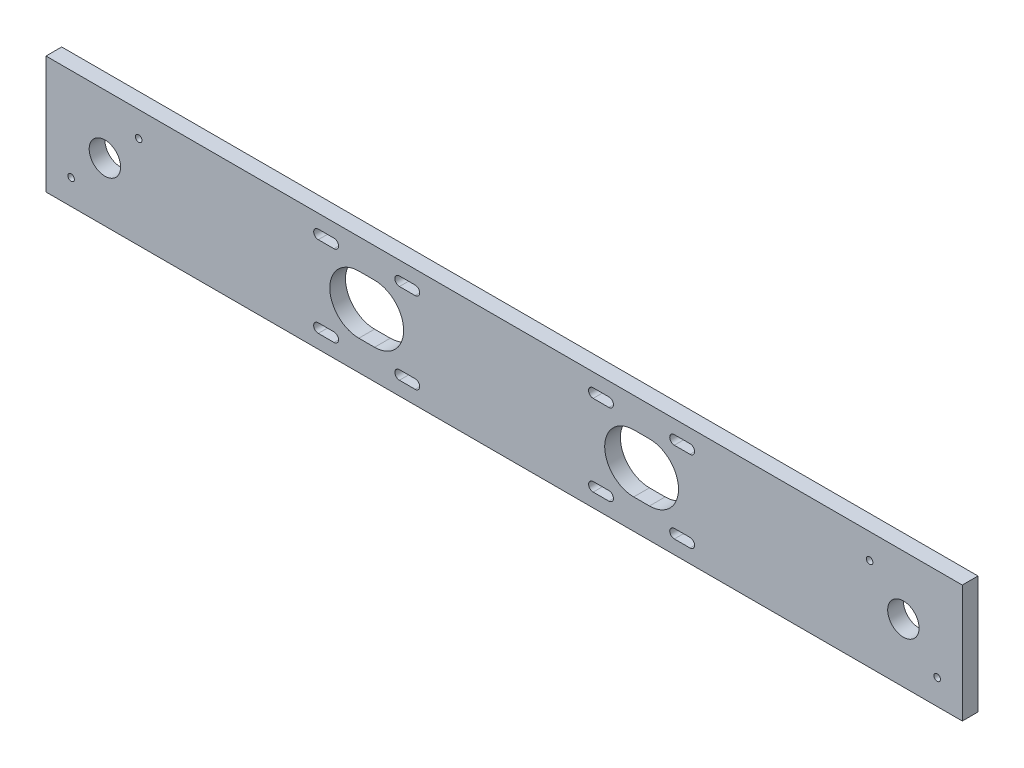
from build123d import *

# Parameters (mm, degrees)
CROQUIS1_W              = 350
CROQUIS1_H              = 45
SALIENTE_EXTRUIR1_DEPTH = 6
CROQUIS2_R              = 6
CROQUIS2_R_2            = 1.25
CORTAR_EXTRUIR1_DEPTH   = 353.932004783
CORTAR_EXTRUIR2_DEPTH   = 353.932004783


with BuildPart() as part:
    # Croquis1 → Saliente-Extruir1 (new body)
    with BuildSketch(Plane.XY):
        with Locations((-175, -22.5)):
            Rectangle(CROQUIS1_W, CROQUIS1_H)
    extrude(amount=SALIENTE_EXTRUIR1_DEPTH)

    # Croquis2 → Cortar-Extruir1 (cut, through all)
    with BuildSketch(Plane.XY.offset(6)):
        with Locations((-327.5, -22.5)):
            Circle(CROQUIS2_R)
        with Locations((-22.5, -22.5)):
            Circle(CROQUIS2_R)
        with Locations((-314.595301243, -9.595301243)):
            Circle(CROQUIS2_R_2)
        with Locations((-340.404698757, -35.404698757)):
            Circle(CROQUIS2_R_2)
        with Locations((-35.404698757, -9.595301243)):
            Circle(CROQUIS2_R_2)
        with Locations((-9.595301243, -35.404698757)):
            Circle(CROQUIS2_R_2)
    extrude(amount=-CORTAR_EXTRUIR1_DEPTH, mode=Mode.SUBTRACT)

    # Croquis3 → Cortar-Extruir2 (cut, through all)
    with BuildSketch(Plane.XY.offset(6)):
        with BuildLine():
            Line((-141, -5.25), (-135, -5.25))
            ThreePointArc((-135, -5.25), (-133.25, -7), (-135, -8.75))
            Line((-135, -8.75), (-141, -8.75))
            ThreePointArc((-141, -8.75), (-142.75, -7), (-141, -5.25))
        make_face()
        with BuildLine():
            Line((-125.5, -11.4), (-119.5, -11.4))
            ThreePointArc((-119.5, -11.4), (-108.4, -22.5), (-119.5, -33.6))
            Line((-119.5, -33.6), (-125.5, -33.6))
            ThreePointArc((-125.5, -33.6), (-136.6, -22.5), (-125.5, -11.4))
        make_face()
        with BuildLine():
            Line((-141, -36.25), (-135, -36.25))
            ThreePointArc((-135, -36.25), (-133.25, -38), (-135, -39.75))
            Line((-135, -39.75), (-141, -39.75))
            ThreePointArc((-141, -39.75), (-142.75, -38), (-141, -36.25))
        make_face()
        with BuildLine():
            Line((-110, -5.25), (-104, -5.25))
            ThreePointArc((-104, -5.25), (-102.25, -7), (-104, -8.75))
            Line((-104, -8.75), (-110, -8.75))
            ThreePointArc((-110, -8.75), (-111.75, -7), (-110, -5.25))
        make_face()
        with BuildLine():
            Line((-110, -36.25), (-104, -36.25))
            ThreePointArc((-104, -36.25), (-102.25, -38), (-104, -39.75))
            Line((-104, -39.75), (-110, -39.75))
            ThreePointArc((-110, -39.75), (-111.75, -38), (-110, -36.25))
        make_face()
        with BuildLine():
            Line((-246, -5.25), (-240, -5.25))
            ThreePointArc((-240, -5.25), (-238.25, -7), (-240, -8.75))
            Line((-240, -8.75), (-246, -8.75))
            ThreePointArc((-246, -8.75), (-247.75, -7), (-246, -5.25))
        make_face()
        with BuildLine():
            Line((-230.5, -11.4), (-224.5, -11.4))
            ThreePointArc((-224.5, -11.4), (-213.4, -22.5), (-224.5, -33.6))
            Line((-224.5, -33.6), (-230.5, -33.6))
            ThreePointArc((-230.5, -33.6), (-241.6, -22.5), (-230.5, -11.4))
        make_face()
        with BuildLine():
            Line((-246, -36.25), (-240, -36.25))
            ThreePointArc((-240, -36.25), (-238.25, -38), (-240, -39.75))
            Line((-240, -39.75), (-246, -39.75))
            ThreePointArc((-246, -39.75), (-247.75, -38), (-246, -36.25))
        make_face()
        with BuildLine():
            Line((-215, -5.25), (-209, -5.25))
            ThreePointArc((-209, -5.25), (-207.25, -7), (-209, -8.75))
            Line((-209, -8.75), (-215, -8.75))
            ThreePointArc((-215, -8.75), (-216.75, -7), (-215, -5.25))
        make_face()
        with BuildLine():
            Line((-215, -36.25), (-209, -36.25))
            ThreePointArc((-209, -36.25), (-207.25, -38), (-209, -39.75))
            Line((-209, -39.75), (-215, -39.75))
            ThreePointArc((-215, -39.75), (-216.75, -38), (-215, -36.25))
        make_face()
    extrude(amount=-CORTAR_EXTRUIR2_DEPTH, mode=Mode.SUBTRACT)


solid = part.part
